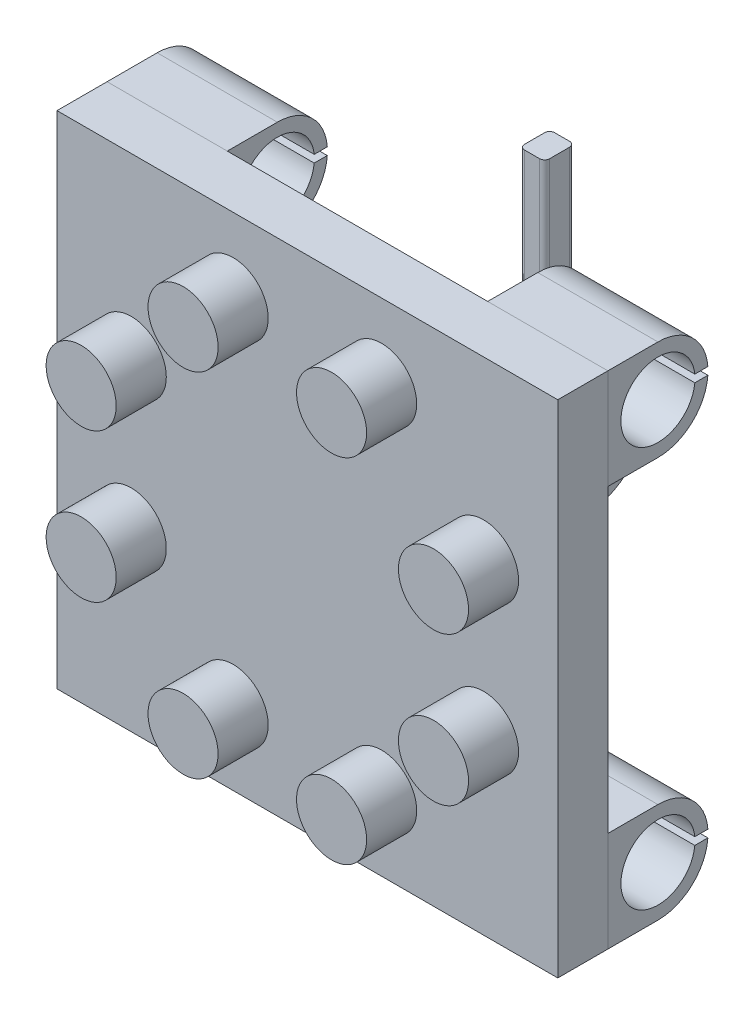
from build123d import *

# Parameters (mm, degrees)
ESBO_O1_W                  = 50
ESBO_O1_H                  = 50
RESSALTO_EXTRUS_O1_DEPTH   = 10
ESBO_O2_R                  = 7
RESSALTO_EXTRUS_O2_DEPTH   = 10
ESPELHAR13_COPY_1_SKETCH_W = 50
ESPELHAR13_COPY_1_SKETCH_H = 50
ESPELHAR13_COPY_1_DEPTH    = 10
ESPELHAR13_COPY_2_SKETCH_R = 7
ESPELHAR13_COPY_2_DEPTH    = 10
ESPELHAR13_COPY_3_SKETCH_W = 50
ESPELHAR13_COPY_3_SKETCH_H = 50
ESPELHAR13_COPY_3_DEPTH    = 10
ESPELHAR13_COPY_4_SKETCH_R = 7
ESPELHAR13_COPY_4_DEPTH    = 10
ESBO_O3_W                  = 24
ESBO_O3_H                  = 20
RESSALTO_EXTRUS_O3_DEPTH   = 20
RESSALTO_EXTRUS_O3_2_DEPTH = 20
RESSALTO_EXTRUS_O3_3_DEPTH = 20
RESSALTO_EXTRUS_O3_4_DEPTH = 20
FILETE3_R                  = 10
FILETE4_R                  = 10
FILETE5_R                  = 10
FILETE6_R                  = 10
CORTE_EXTRUS_O1_DEPTH      = 129.4146105
CORTE_EXTRUS_O1_DEPTH_BACK = 129.4146105
ESBO_O5_W                  = 35
ESBO_O5_H                  = 30
RESSALTO_EXTRUS_O4_DEPTH   = 50
CORTE_EXTRUS_O2_DEPTH      = 112.722433691
CORTE_EXTRUS_O2_DEPTH_BACK = 112.722433691
ESBO_O6_R                  = 11.5
CORTE_EXTRUS_O3_DEPTH      = 15
ESBO_O8_R                  = 5.25
CORTE_EXTRUS_O4_DEPTH      = 107.520243146
FILETE7_R                  = 10
RESSALTO_EXTRUS_O5_DEPTH   = 30


with BuildPart() as part:
    # Esboço1 → Ressalto-extrusão1 (new body)
    with BuildSketch(Plane.XY):
        with Locations((-0.874252483, -3.040452266)):
            Rectangle(ESBO_O1_W, ESBO_O1_H)
    ressalto_extrus_o1 = extrude(amount=RESSALTO_EXTRUS_O1_DEPTH)

    # Esboço2 → Ressalto-extrusão2 (add)
    with BuildSketch(Plane.XY.offset(10)):
        with Locations((-11.048693649, 7.1339889)):
            Circle(ESBO_O2_R)
        with Locations((9.300188683, -13.214893432)):
            Circle(ESBO_O2_R)
    ressalto_extrus_o2 = extrude(amount=RESSALTO_EXTRUS_O2_DEPTH)

    # Espelhar11: Ressalto-extrusão1, Ressalto-extrusão2 across plane
    add(ressalto_extrus_o1.mirror(Plane(origin=(-25.874252483, 21.959547734, 10), x_dir=(0, 0, 1), z_dir=(1, 0, 0))))
    add(ressalto_extrus_o2.mirror(Plane(origin=(-25.874252483, 21.959547734, 10), x_dir=(0, 0, 1), z_dir=(1, 0, 0))))

    # Espelhar12: Ressalto-extrusão1, Ressalto-extrusão2 across plane
    add(ressalto_extrus_o1.mirror(Plane(origin=(-25.874252483, -28.040452266, 10), x_dir=(0, 0, 1), z_dir=(0, 1, 0))))
    add(ressalto_extrus_o2.mirror(Plane(origin=(-25.874252483, -28.040452266, 10), x_dir=(0, 0, 1), z_dir=(0, 1, 0))))

    # Espelhar13 copy 1 sketch → Espelhar13 copy 1 (add)
    with BuildSketch(Plane(origin=(-51.748504966, -56.080904531, 0), x_dir=(-1, 0, 0), z_dir=(0, 0, 1))):
        with Locations((-0.874252483, -3.040452266)):
            Rectangle(ESPELHAR13_COPY_1_SKETCH_W, ESPELHAR13_COPY_1_SKETCH_H)
    extrude(amount=ESPELHAR13_COPY_1_DEPTH)

    # Espelhar13 copy 2 sketch → Espelhar13 copy 2 (add)
    with BuildSketch(Plane(origin=(-51.748504966, -56.080904531, 10), x_dir=(-1, 0, 0), z_dir=(0, 0, 1))):
        with Locations((-11.048693649, 7.1339889)):
            Circle(ESPELHAR13_COPY_2_SKETCH_R)
        with Locations((9.300188683, -13.214893432)):
            Circle(ESPELHAR13_COPY_2_SKETCH_R)
    extrude(amount=ESPELHAR13_COPY_2_DEPTH)

    # Espelhar13 copy 3 sketch → Espelhar13 copy 3 (add)
    with BuildSketch(Plane(origin=(-51.748504966, 0, 0), x_dir=(-1, 0, 0), z_dir=(0, 0, 1))):
        with Locations((-0.874252483, 3.040452266)):
            Rectangle(ESPELHAR13_COPY_3_SKETCH_W, ESPELHAR13_COPY_3_SKETCH_H)
    extrude(amount=ESPELHAR13_COPY_3_DEPTH)

    # Espelhar13 copy 4 sketch → Espelhar13 copy 4 (add)
    with BuildSketch(Plane(origin=(-51.748504966, 0, 10), x_dir=(-1, 0, 0), z_dir=(0, 0, 1))):
        with Locations((-11.048693649, -7.1339889)):
            Circle(ESPELHAR13_COPY_4_SKETCH_R)
        with Locations((9.300188683, 13.214893432)):
            Circle(ESPELHAR13_COPY_4_SKETCH_R)
    extrude(amount=ESPELHAR13_COPY_4_DEPTH)

    # Esboço5 → Ressalto-extrusão4 (add)
    with BuildSketch(Plane(origin=(0, 0, 0), x_dir=(-1, 0, 0), z_dir=(0, 0, -1))):
        with Locations((25.874252483, -28.040452266)):
            Rectangle(ESBO_O5_W, ESBO_O5_H)
    extrude(amount=RESSALTO_EXTRUS_O4_DEPTH)

    # Esboço7 → Corte-extrusão2 (cut, two sides: drawn at the far end of the back side and taken through both)
    with BuildSketch(Plane.XZ.offset(43.040452266).offset(-CORTE_EXTRUS_O2_DEPTH_BACK)):
        with BuildLine():
            Line((-8.374252483, 0), (-8.374252483, -50))
            Line((-8.374252483, -50), (-18.874252483, -50))
            ThreePointArc((-18.874252483, -50), (-16.220932935, -24.454697105), (-8.374252483, 0))
        make_face()
        with BuildLine():
            Line((-43.374252483, 0), (-43.374252483, -50))
            Line((-43.374252483, -50), (-32.874252483, -50))
            ThreePointArc((-32.874252483, -50), (-35.52757203, -24.454697105), (-43.374252483, 0))
        make_face()
    extrude(amount=CORTE_EXTRUS_O2_DEPTH + CORTE_EXTRUS_O2_DEPTH_BACK, mode=Mode.SUBTRACT)

    # Esboço6 → Corte-extrusão3 (cut)
    with BuildSketch(Plane.ZY.offset(43.374252483)):
        with Locations(Location((-37.5, -28.040452266, 0), (0, 0, 270))):
            Circle(ESBO_O6_R)
    extrude(amount=-CORTE_EXTRUS_O3_DEPTH, mode=Mode.SUBTRACT)

    # Esboço8 → Corte-extrusão4 (cut, through all)
    with BuildSketch(Plane.ZY.offset(28.374252483)):
        with Locations(Location((-37.5, -28.040452266, 0), (0, 0, 270))):
            Circle(ESBO_O8_R)
    extrude(amount=-CORTE_EXTRUS_O4_DEPTH, mode=Mode.SUBTRACT)

    # Filete7
    filete7_edges = [part.edges().sort_by_distance(p)[0] for p in [
        (-25.874252483, -13.040452266, -50),
        (-25.874252483, -43.040452266, -50),
    ]]
    fillet(filete7_edges, radius=FILETE7_R)

    # Esboço9 → Ressalto-extrusão5 (add)
    with BuildSketch(Plane(origin=(0, -13.040452266, 0), x_dir=(1, 0, 0), z_dir=(0, 1, 0))):
        with BuildLine():
            Line((-27.374252483, 40.870080229), (-24.374252483, 40.870080229))
            ThreePointArc((-24.374252483, 40.870080229), (-23.667145702, 40.57718701), (-23.374252483, 39.870080229))
            Line((-23.374252483, 39.870080229), (-23.374252483, 35.870080229))
            ThreePointArc((-23.374252483, 35.870080229), (-23.667145702, 35.162973448), (-24.374252483, 34.870080229))
            Line((-24.374252483, 34.870080229), (-27.374252483, 34.870080229))
            ThreePointArc((-27.374252483, 34.870080229), (-28.081359264, 35.162973448), (-28.374252483, 35.870080229))
            Line((-28.374252483, 35.870080229), (-28.374252483, 39.870080229))
            ThreePointArc((-28.374252483, 39.870080229), (-28.081359264, 40.57718701), (-27.374252483, 40.870080229))
        make_face()
    extrude(amount=RESSALTO_EXTRUS_O5_DEPTH)


with BuildPart() as body_2:
    # Esboço3 → Ressalto-extrusão3 (new body)
    with BuildSketch(Plane(origin=(0, 0, 0), x_dir=(-1, 0, 0), z_dir=(0, 0, -1))):
        with Locations((-12.125747517, -68.040452266)):
            Rectangle(ESBO_O3_W, ESBO_O3_H)
    extrude(amount=RESSALTO_EXTRUS_O3_DEPTH)

    # Filete3
    filete3_edges = [body_2.edges().sort_by_distance(p)[0] for p in [
        (12.125747517, -58.040452266, -20),
        (12.125747517, -78.040452266, -20),
    ]]
    fillet(filete3_edges, radius=FILETE3_R - 0.0001)  # a hair under: the kernel refuses the full size


with BuildPart() as body_3:
    # Esboço3 → Ressalto-extrus_o3 2 (new body)
    with BuildSketch(Plane(origin=(0, 0, 0), x_dir=(-1, 0, 0), z_dir=(0, 0, -1))):
        with Locations((63.874252483, -68.040452266)):
            Rectangle(ESBO_O3_W, ESBO_O3_H)
    extrude(amount=RESSALTO_EXTRUS_O3_2_DEPTH)

    # Filete4
    filete4_edges = [body_3.edges().sort_by_distance(p)[0] for p in [
        (-63.874252483, -58.040452266, -20),
        (-63.874252483, -78.040452266, -20),
    ]]
    fillet(filete4_edges, radius=FILETE4_R - 0.0001)  # a hair under: the kernel refuses the full size


with BuildPart() as body_4:
    # Esboço3 → Ressalto-extrus_o3 3 (new body)
    with BuildSketch(Plane(origin=(0, 0, 0), x_dir=(-1, 0, 0), z_dir=(0, 0, -1))):
        with Locations((63.874252483, 11.959547734)):
            Rectangle(ESBO_O3_W, ESBO_O3_H)
    extrude(amount=RESSALTO_EXTRUS_O3_3_DEPTH)

    # Filete6
    filete6_edges = [body_4.edges().sort_by_distance(p)[0] for p in [
        (-63.874252483, 21.959547734, -20),
        (-63.874252483, 1.959547734, -20),
    ]]
    fillet(filete6_edges, radius=FILETE6_R - 0.0001)  # a hair under: the kernel refuses the full size


with BuildPart() as body_5:
    # Esboço3 → Ressalto-extrus_o3 4 (new body)
    with BuildSketch(Plane(origin=(0, 0, 0), x_dir=(-1, 0, 0), z_dir=(0, 0, -1))):
        with Locations((-12.125747517, 11.959547734)):
            Rectangle(ESBO_O3_W, ESBO_O3_H)
    extrude(amount=RESSALTO_EXTRUS_O3_4_DEPTH)

    # Filete5
    filete5_edges = [body_5.edges().sort_by_distance(p)[0] for p in [
        (12.125747517, 21.959547734, -20),
        (12.125747517, 1.959547734, -20),
    ]]
    fillet(filete5_edges, radius=FILETE5_R - 0.0001)  # a hair under: the kernel refuses the full size


with BuildPart() as corte_extrus_o1_tool:
    # Esboço4 → Corte-extrusão1 (new, two sides: drawn at the far end of the back side and taken through both)
    with BuildSketch(Plane(origin=(24.125747517, 0, 0), x_dir=(0, 0, -1), z_dir=(1, 0, 0)).offset(-CORTE_EXTRUS_O1_DEPTH_BACK)):
        with BuildLine():
            Line((20.351378214, -68.790452266), (17.361895136, -68.790452266))
            ThreePointArc((17.361895136, -68.790452266), (2.6, -68.040452266), (17.361895136, -67.290452266))
            Line((17.361895136, -67.290452266), (20.351378214, -67.290452266))
            Line((20.351378214, -67.290452266), (20.351378214, -68.790452266))
        make_face()
        with BuildLine():
            Line((20.351378214, 11.209547734), (17.361895136, 11.209547734))
            ThreePointArc((17.361895136, 11.209547734), (2.6, 11.959547734), (17.361895136, 12.709547734))
            Line((17.361895136, 12.709547734), (20.351378214, 12.709547734))
            Line((20.351378214, 12.709547734), (20.351378214, 11.209547734))
        make_face()
    extrude(amount=CORTE_EXTRUS_O1_DEPTH + CORTE_EXTRUS_O1_DEPTH_BACK)


with BuildPart() as body_2_1:
    add(body_2.part)

    # Corte-extrusão1: cut by corte_extrus_o1_tool
    add(corte_extrus_o1_tool.part, mode=Mode.SUBTRACT)


with BuildPart() as body_3_1:
    add(body_3.part)

    # Corte-extrusão1: cut by corte_extrus_o1_tool
    add(corte_extrus_o1_tool.part, mode=Mode.SUBTRACT)


with BuildPart() as body_4_1:
    add(body_4.part)

    # Corte-extrusão1: cut by corte_extrus_o1_tool
    add(corte_extrus_o1_tool.part, mode=Mode.SUBTRACT)


with BuildPart() as body_5_1:
    add(body_5.part)

    # Corte-extrusão1: cut by corte_extrus_o1_tool
    add(corte_extrus_o1_tool.part, mode=Mode.SUBTRACT)


solid = Compound([part.part, body_2_1.part, body_3_1.part, body_4_1.part, body_5_1.part])
